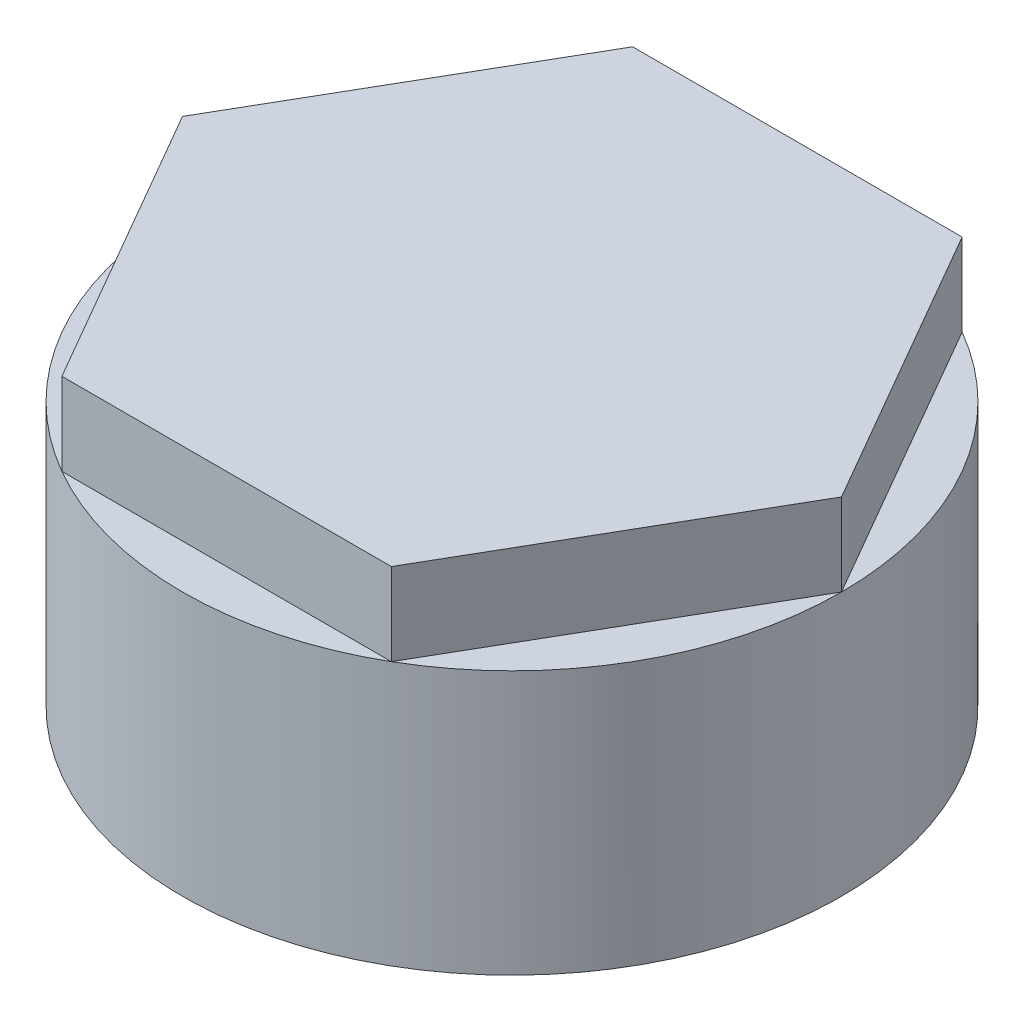
from build123d import *

# Parameters (mm, degrees)
TAGLIO_ESTRUSIONE1_START = -5
TAGLIO_ESTRUSIONE1_DEPTH = 5


with BuildPart() as part:
    # Schizzo1 → Rivoluzione1 (revolve)
    with BuildSketch(Plane.XY):
        Polygon((-15.5465, 0), (-15.5465, 15), (0, 15), (0, 21), (-20, 21), (-20, 0), align=None)
    revolve(axis=Axis((0, 0, 0), (0, 1, 0)))

    # Schizzo2 → Taglio-Estrusione1 (cut)
    with BuildSketch(Plane(origin=(0, 21, 0), x_dir=(1, 0, 0), z_dir=(0, 1, 0)).offset(TAGLIO_ESTRUSIONE1_START)):
        with BuildLine():
            ThreePointArc((10, 17.320508076), (0, 20), (-10, 17.320508076))
            Line((-10, 17.320508076), (10, 17.320508076))
        make_face()
        with BuildLine():
            Line((-20, 0), (-10, 17.320508076))
            ThreePointArc((-10, 17.320508076), (-17.320508076, 10), (-20, 0))
        make_face()
        with BuildLine():
            ThreePointArc((20, 0), (17.320508076, 10), (10, 17.320508076))
            Line((10, 17.320508076), (20, 0))
        make_face()
        with BuildLine():
            Line((-10, -17.320508076), (-20, 0))
            ThreePointArc((-20, 0), (-17.320508076, -10), (-10, -17.320508076))
        make_face()
        with BuildLine():
            ThreePointArc((10, -17.320508076), (17.320508076, -10), (20, 0))
            Line((20, 0), (10, -17.320508076))
        make_face()
        with BuildLine():
            Line((10, -17.320508076), (-10, -17.320508076))
            ThreePointArc((-10, -17.320508076), (0, -20), (10, -17.320508076))
        make_face()
    extrude(amount=TAGLIO_ESTRUSIONE1_DEPTH, mode=Mode.SUBTRACT)


solid = part.part
